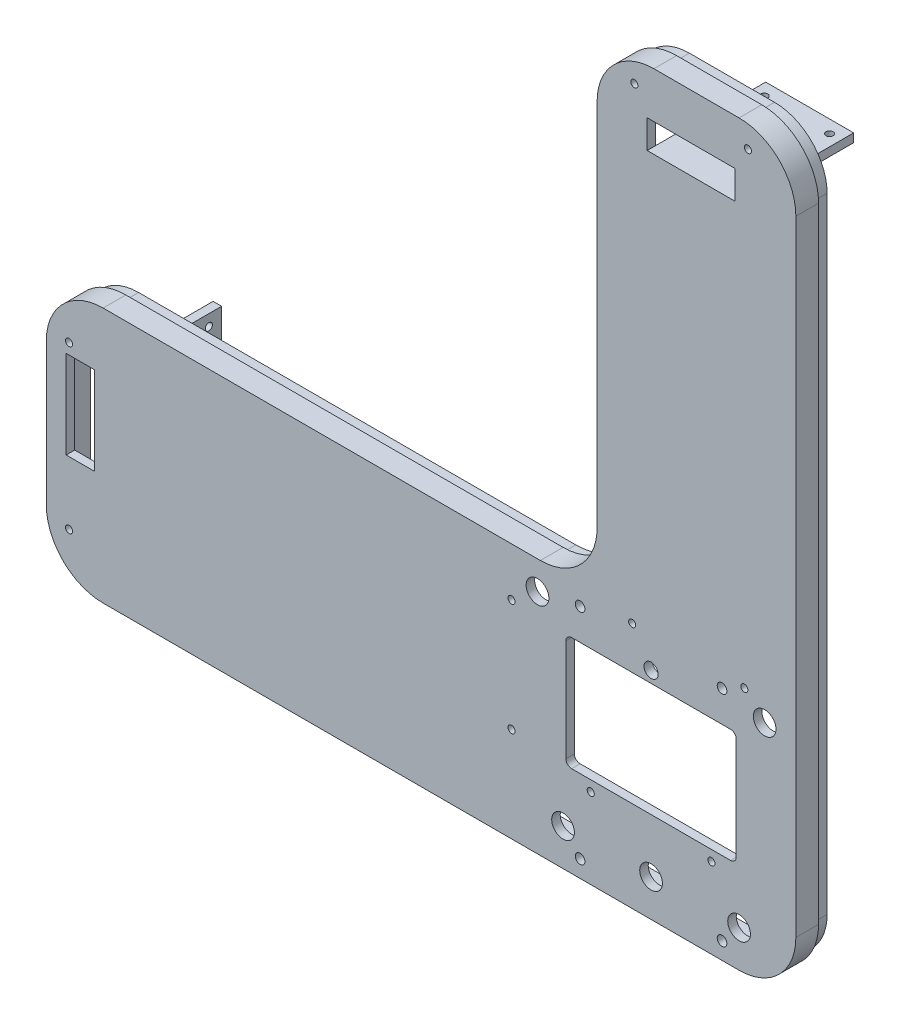
from build123d import *

# Parameters (mm, degrees)
BOX_EXTRUDE_DEPTH                 = 12.5
SHELL1_T                          = -3
CUT_SWEEP_START                   = -12.5
CUT_SWEEP_DEPTH                   = 4.5
SKETCH2_W                         = 10
SKETCH2_H                         = 10
SQUARES_EXTRUDE_DEPTH             = 9.5
SKETCH11_W                        = 10
SKETCH11_H                        = 31
SKETCH11_W_2                      = 31
SKETCH11_H_2                      = 10
CUT_EXTRUDE2_DEPTH                = 264.732611064
SQUARES_M3_CLEARANCE_HOLES_D      = 2.5
SQUARES_M3_CLEARANCE_HOLES_DEPTH  = 2
SQUARES_M3_CLEARANCE_HOLES_TIP    = 0.751075774
F_8_0MM_DOWEL_HOLE1_D             = 8
F_8_0MM_DOWEL_HOLE1_DEPTH         = 7.5
F_8_0MM_DOWEL_HOLE1_TIP           = 2.403442476
F_5_0MM_DOWEL_HOLE1_D             = 5
F_5_0MM_DOWEL_HOLE1_DEPTH         = 7.5
F_5_0MM_DOWEL_HOLE1_TIP           = 1.502151548
M3_CLEARANCE_HOLE3_D              = 3.4
M3_CLEARANCE_HOLE3_DEPTH          = 7.5
M3_CLEARANCE_HOLE3_TIP            = 1.021463052
M3X0_5_TAPPED_HOLE1_D             = 2.5
M3X0_5_TAPPED_HOLE2_D             = 2.5
M3X0_5_TAPPED_HOLE2_DEPTH         = 7.5
M3X0_5_TAPPED_HOLE2_TIP           = 0.751075774
SKETCH25_W                        = 3
SKETCH25_H                        = 31
SKETCH25_W_2                      = 31
SKETCH25_H_2                      = 3
DRIVER_BOARD_HOLDER_EXTRUDE_DEPTH = 38.75
F_2_5MM_DOWEL_HOLE1_D             = 2.5
F_2_5MM_DOWEL_HOLE1_ON_FACE_2_D   = 2.5


# Read off the part's stored shape, not the designer's step: Cut-Sweep
with BuildPart() as part:
    # Sketch1 → Box-Extrude (new body)
    with BuildSketch(Plane.XY):
        with BuildLine():
            Line((-54.633571826, -76.683344949), (169.366428174, -76.683344949))
            ThreePointArc((169.366428174, -76.683344949), (183.508563798, -70.825480573), (189.366428174, -56.683344949))
            Line((189.366428174, -56.683344949), (189.366428174, 163.316655051))
            ThreePointArc((189.366428174, 163.316655051), (183.508563798, 177.458790675), (169.366428174, 183.316655051))
            Line((169.366428174, 183.316655051), (139.366428174, 183.316655051))
            ThreePointArc((139.366428174, 183.316655051), (125.22429255, 177.458790675), (119.366428174, 163.316655051))
            Line((119.366428174, 163.316655051), (119.366428174, 33.316655051))
            ThreePointArc((119.366428174, 33.316655051), (113.508563798, 19.174519427), (99.366428174, 13.316655051))
            Line((99.366428174, 13.316655051), (-54.633571826, 13.316655051))
            ThreePointArc((-54.633571826, 13.316655051), (-68.77570745, 7.458790675), (-74.633571826, -6.683344949))
            Line((-74.633571826, -6.683344949), (-74.633571826, -56.683344949))
            ThreePointArc((-74.633571826, -56.683344949), (-68.77570745, -70.825480573), (-54.633571826, -76.683344949))
        make_face()
    extrude(amount=-BOX_EXTRUDE_DEPTH)

    # Shell1
    shell1_openings = [part.faces().sort_by_distance(p)[0] for p in [
        (90.029023859, 11.315684384, -12.5),
    ]]
    offset(amount=SHELL1_T, openings=shell1_openings, kind=Kind.INTERSECTION)

    # Cut-Sweep outline → Cut-Sweep (cut)
    with BuildSketch(Plane.XY.offset(CUT_SWEEP_START)):
        with BuildLine():
            Line((189.366428174, -56.683344949), (189.366428174, 163.316655051))
            ThreePointArc((189.366428174, 163.316655051), (183.508563798, 177.458790675), (169.366428174, 183.316655051))
            Line((169.366428174, 183.316655051), (139.366428174, 183.316655051))
            ThreePointArc((139.366428174, 183.316655051), (125.22429255, 177.458790675), (119.366428174, 163.316655051))
            Line((119.366428174, 163.316655051), (119.366428174, 33.316655051))
            ThreePointArc((119.366428174, 33.316655051), (113.508563798, 19.174519427), (99.366428174, 13.316655051))
            Line((99.366428174, 13.316655051), (-54.633571826, 13.316655051))
            ThreePointArc((-54.633571826, 13.316655051), (-68.77570745, 7.458790675), (-74.633571826, -6.683344949))
            Line((-74.633571826, -6.683344949), (-74.633571826, -56.683344949))
            ThreePointArc((-74.633571826, -56.683344949), (-68.77570745, -70.825480573), (-54.633571826, -76.683344949))
            Line((-54.633571826, -76.683344949), (169.366428174, -76.683344949))
            ThreePointArc((169.366428174, -76.683344949), (183.508563798, -70.825480573), (189.366428174, -56.683344949))
        make_face()
        with BuildLine():
            Line((169.366428174, -75.183344949), (-54.633571826, -75.183344949))
            ThreePointArc((-54.633571826, -75.183344949), (-67.715047278, -69.764820401), (-73.133571826, -56.683344949))
            Line((-73.133571826, -56.683344949), (-73.133571826, -6.683344949))
            ThreePointArc((-73.133571826, -6.683344949), (-67.715047278, 6.398130503), (-54.633571826, 11.816655051))
            Line((-54.633571826, 11.816655051), (99.366428174, 11.816655051))
            ThreePointArc((99.366428174, 11.816655051), (114.569223969, 18.113859256), (120.866428174, 33.316655051))
            Line((120.866428174, 33.316655051), (120.866428174, 163.316655051))
            ThreePointArc((120.866428174, 163.316655051), (126.284952722, 176.398130503), (139.366428174, 181.816655051))
            Line((139.366428174, 181.816655051), (169.366428174, 181.816655051))
            ThreePointArc((169.366428174, 181.816655051), (182.447903626, 176.398130503), (187.866428174, 163.316655051))
            Line((187.866428174, 163.316655051), (187.866428174, -56.683344949))
            ThreePointArc((187.866428174, -56.683344949), (182.447903626, -69.764820401), (169.366428174, -75.183344949))
        make_face(mode=Mode.SUBTRACT)
    extrude(amount=CUT_SWEEP_DEPTH, mode=Mode.SUBTRACT)

    # Sketch2 → Squares-Extrude (add)
    with BuildSketch(Plane.XY.offset(-3)):
        with Locations((41.816428174, 5.316655051)):
            Rectangle(SKETCH2_W, SKETCH2_H)
        with Locations((181.366428174, -33.683344949)):
            Rectangle(SKETCH2_W, SKETCH2_H)
        with Locations((41.366428174, -68.683344949)):
            Rectangle(SKETCH2_W, SKETCH2_H)
        with Locations((181.366428174, 140.316655051)):
            Rectangle(SKETCH2_W, SKETCH2_H)
    extrude(amount=-SQUARES_EXTRUDE_DEPTH)

    # Sketch11 → Cut-Extrude2 (cut, through all)
    with BuildSketch(Plane(origin=(0, 0, -3), x_dir=(-1, 0, 0), z_dir=(0, 0, -1))):
        with BuildLine():
            Line((-166.366428174, -44.683344949), (-110.366428174, -44.683344949))
            ThreePointArc((-110.366428174, -44.683344949), (-108.952214612, -44.097558511), (-108.366428174, -42.683344949))
            Line((-108.366428174, -42.683344949), (-108.366428174, -6.683344949))
            ThreePointArc((-108.366428174, -6.683344949), (-108.952214612, -5.269131386), (-110.366428174, -4.683344949))
            Line((-110.366428174, -4.683344949), (-166.366428174, -4.683344949))
            ThreePointArc((-166.366428174, -4.683344949), (-167.780641736, -5.269131386), (-168.366428174, -6.683344949))
            Line((-168.366428174, -6.683344949), (-168.366428174, -42.683344949))
            ThreePointArc((-168.366428174, -42.683344949), (-167.780641736, -44.097558511), (-166.366428174, -44.683344949))
        make_face()
        with Locations((62.633571826, -22.513344949)):
            Rectangle(SKETCH11_W, SKETCH11_H)
        with Locations((-152.479428174, 162.176655051)):
            Rectangle(SKETCH11_W_2, SKETCH11_H_2)
    extrude(amount=-CUT_EXTRUDE2_DEPTH, mode=Mode.SUBTRACT)

    # Squares M3 Clearance Holes
    with Locations(Plane(origin=(0, 0, -12.5), x_dir=(1, 0, 0), z_dir=(0, 0, -1))):
        with Locations((41.816428174, -5.316655051), (181.366428174, -140.316655051), (181.366428174, 33.683344949), (41.366428174, 68.683344949)):
            Hole(SQUARES_M3_CLEARANCE_HOLES_D / 2, depth=SQUARES_M3_CLEARANCE_HOLES_DEPTH)
            with Locations((0, 0, -(SQUARES_M3_CLEARANCE_HOLES_DEPTH + SQUARES_M3_CLEARANCE_HOLES_TIP / 2))):  # 118° drill point
                Cone(0, SQUARES_M3_CLEARANCE_HOLES_D / 2, SQUARES_M3_CLEARANCE_HOLES_TIP, mode=Mode.SUBTRACT)

    # Ø8.0mm Dowel Hole1
    with Locations(Plane(origin=(169.366428174, -63.683344949, -3), x_dir=(-1, 0, 0), z_dir=(0, 0, -1))):
        with Locations((0, 0), (31, 0), (62, 0), (71, 67), (-9, 67)):
            Hole(F_8_0MM_DOWEL_HOLE1_D / 2, depth=F_8_0MM_DOWEL_HOLE1_DEPTH)
            with Locations((0, 0, -(F_8_0MM_DOWEL_HOLE1_DEPTH + F_8_0MM_DOWEL_HOLE1_TIP / 2))):  # 118° drill point
                Cone(0, F_8_0MM_DOWEL_HOLE1_D / 2, F_8_0MM_DOWEL_HOLE1_TIP, mode=Mode.SUBTRACT)

    # Ø5.0mm Dowel Hole1
    with Locations(Plane(origin=(0, 0, -3), x_dir=(-1, 0, 0), z_dir=(0, 0, -1))):
        with Locations((-138.366428174, -0.683344949)):
            Hole(F_5_0MM_DOWEL_HOLE1_D / 2, depth=F_5_0MM_DOWEL_HOLE1_DEPTH)
            with Locations((0, 0, -(F_5_0MM_DOWEL_HOLE1_DEPTH + F_5_0MM_DOWEL_HOLE1_TIP / 2))):  # 118° drill point
                Cone(0, F_5_0MM_DOWEL_HOLE1_D / 2, F_5_0MM_DOWEL_HOLE1_TIP, mode=Mode.SUBTRACT)

    # M3 Clearance Hole3
    with Locations(Plane(origin=(0, 0, -3), x_dir=(-1, 0, 0), z_dir=(0, 0, -1))):
        with Locations((-163.366428174, 6.316655051), (-113.366428174, 6.316655051), (-163.366428174, -70.683344949), (-113.366428174, -70.683344949)):
            Hole(M3_CLEARANCE_HOLE3_D / 2, depth=M3_CLEARANCE_HOLE3_DEPTH)
            with Locations((0, 0, -(M3_CLEARANCE_HOLE3_DEPTH + M3_CLEARANCE_HOLE3_TIP / 2))):  # 118° drill point
                Cone(0, M3_CLEARANCE_HOLE3_D / 2, M3_CLEARANCE_HOLE3_TIP, mode=Mode.SUBTRACT)

    # M3x0.5 Tapped Hole1 (through all)
    with Locations(Plane(origin=(0, 0, -3), x_dir=(-1, 0, 0), z_dir=(0, 0, -1))):
        with Locations((-117.116428174, -48.423344949), (-159.616428174, -48.423344949), (-89.226428174, -3.763344949), (-89.226428174, -43.263344949), (-171.219428174, 10.316655051), (-131.719428174, 10.316655051)):
            Hole(M3X0_5_TAPPED_HOLE1_D / 2)

    # M3x0.5 Tapped Hole2
    with Locations(Plane.XY):
        with Locations((-66.633571826, -3.183344949), (-66.633571826, -60.183344949), (172.479428174, 175.316655051), (132.479428174, 175.316655051)):
            Hole(M3X0_5_TAPPED_HOLE2_D / 2, depth=M3X0_5_TAPPED_HOLE2_DEPTH)
            with Locations((0, 0, -(M3X0_5_TAPPED_HOLE2_DEPTH + M3X0_5_TAPPED_HOLE2_TIP / 2))):  # 118° drill point
                Cone(0, M3X0_5_TAPPED_HOLE2_D / 2, M3X0_5_TAPPED_HOLE2_TIP, mode=Mode.SUBTRACT)

    # Sketch25 → Driver Board holder Extrude (add)
    with BuildSketch(Plane(origin=(0, 0, -3), x_dir=(-1, 0, 0), z_dir=(0, 0, -1))):
        with Locations((56.133571826, -22.513344949)):
            Rectangle(SKETCH25_W, SKETCH25_H)
        with Locations((-152.479428174, 155.676655051)):
            Rectangle(SKETCH25_W_2, SKETCH25_H_2)
    extrude(amount=DRIVER_BOARD_HOLDER_EXTRUDE_DEPTH)

    # Ø2.5mm Dowel Hole1 (through all)
    with Locations(Plane(origin=(163.979428174, 154.176655051, -37.25), x_dir=(0, 0, -1), z_dir=(0, -1, 0))):
        with Locations((0, 0), (0, -23), (-23, 0), (-23, -23)):
            Hole(F_2_5MM_DOWEL_HOLE1_D / 2)

    # Ø2.5mm Dowel Hole1 on face 2 (through all)
    with Locations(Plane(origin=(-54.633571826, -11.013344949, -37.25), x_dir=(0, 0, 1), z_dir=(1, 0, 0))):
        with Locations((0, 0), (0, 23), (23, 23), (23, 0)):
            Hole(F_2_5MM_DOWEL_HOLE1_ON_FACE_2_D / 2)


solid = part.part
